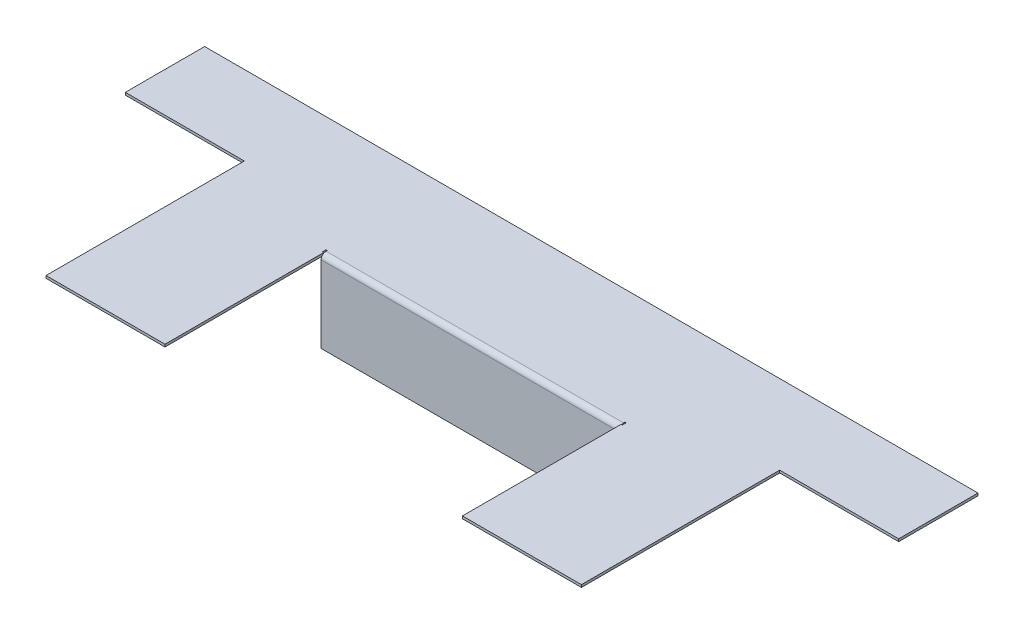
from build123d import *

# Parameters (mm, degrees)
BASE_FLANGE1_DEPTH       = 1.5875
EDGE_FLANGE1_START       = -2.38125
EDGE_FLANGE1_OUTLINE_W   = 0.79375
EDGE_FLANGE1_OUTLINE_H   = 1.5875
EDGE_FLANGE1_DEPTH       = 2.38125
EDGE_FLANGE1_START_2     = 74.6125
EDGE_FLANGE1_2_OUTLINE_W = 190.5
EDGE_FLANGE1_2_OUTLINE_H = 50.8
EDGE_FLANGE1_2_DEPTH     = 3.175
EDGE_FLANGE1_START_3     = 76.2
EDGE_FLANGE1_3_OUTLINE_W = 190.5
EDGE_FLANGE1_3_OUTLINE_H = 1.5875
EDGE_FLANGE1_3_DEPTH     = 1.2613005
EDGE_FLANGE1_START_4     = 152.4
EDGE_FLANGE1_4_DEPTH     = 190.5


with BuildPart() as part:
    # Base-Flange1: sheet metal written as solids
    # Sketch1 → Base-Flange1 (new body)
    with BuildSketch(Plane(origin=(0, 0, 0), x_dir=(1, 0, 0), z_dir=(0, 1, 0))):
        Polygon((0, 0), (495.3, 0), (495.3, -50.8), (419.1, -50.8), (419.1, -177.8), (342.9, -177.8), (342.9, -76.2), (152.4, -76.2), (152.4, -177.8), (76.2, -177.8), (76.2, -50.8), (0, -50.8), align=None)
    extrude(amount=-BASE_FLANGE1_DEPTH)

    # Edge-Flange1: read off the stored shape, not the designer's step
    # Edge-Flange1 outline → Edge-Flange1 (cut)
    with BuildSketch(Plane(origin=(0, -1.5875, 76.2), x_dir=(-1, 0, 0), z_dir=(0, 0, 1)).offset(EDGE_FLANGE1_START)):
        with Locations((-152.003125, -0.79375)):
            Rectangle(EDGE_FLANGE1_OUTLINE_W, EDGE_FLANGE1_OUTLINE_H)
        with Locations((-343.296875, -0.79375)):
            Rectangle(EDGE_FLANGE1_OUTLINE_W, EDGE_FLANGE1_OUTLINE_H)
    extrude(amount=EDGE_FLANGE1_DEPTH, mode=Mode.SUBTRACT)

    # Edge-Flange1 2 outline → Edge-Flange1 2 (add)
    with BuildSketch(Plane.XY.offset(EDGE_FLANGE1_START_2)):
        with Locations((247.65, -26.9875)):
            Rectangle(EDGE_FLANGE1_2_OUTLINE_W, EDGE_FLANGE1_2_OUTLINE_H)
    extrude(amount=EDGE_FLANGE1_2_DEPTH)

    # Edge-Flange1 3 outline → Edge-Flange1 3 (add)
    with BuildSketch(Plane.XY.offset(EDGE_FLANGE1_START_3)):
        with Locations((247.65, -0.79375)):
            Rectangle(EDGE_FLANGE1_3_OUTLINE_W, EDGE_FLANGE1_3_OUTLINE_H)
    extrude(amount=EDGE_FLANGE1_3_DEPTH)

    # Edge-Flange1 4 outline → Edge-Flange1 4 (cut)
    with BuildSketch(Plane.YZ.offset(EDGE_FLANGE1_START_4)):
        with BuildLine():
            Line((-3.175, 76.2), (-52.3875, 76.2))
            Line((-52.3875, 76.2), (-52.3875, 74.6125))
            Line((-52.3875, 74.6125), (-1.5875, 74.6125))
            ThreePointArc((-1.5875, 74.6125), (-2.052467985, 75.735032015), (-3.175, 76.2))
        make_face()
        with BuildLine():
            Line((-1.5875, 77.7875), (-3.175, 77.7875))
            ThreePointArc((-3.175, 77.7875), (-0.92993597, 76.85756403), (0, 74.6125))
            Line((0, 74.6125), (0, 77.4613005))
            Line((0, 77.4613005), (-1.5875, 77.4613005))
            Line((-1.5875, 77.4613005), (-1.5875, 77.7875))
        make_face()
    extrude(amount=EDGE_FLANGE1_4_DEPTH, mode=Mode.SUBTRACT)


solid = part.part
